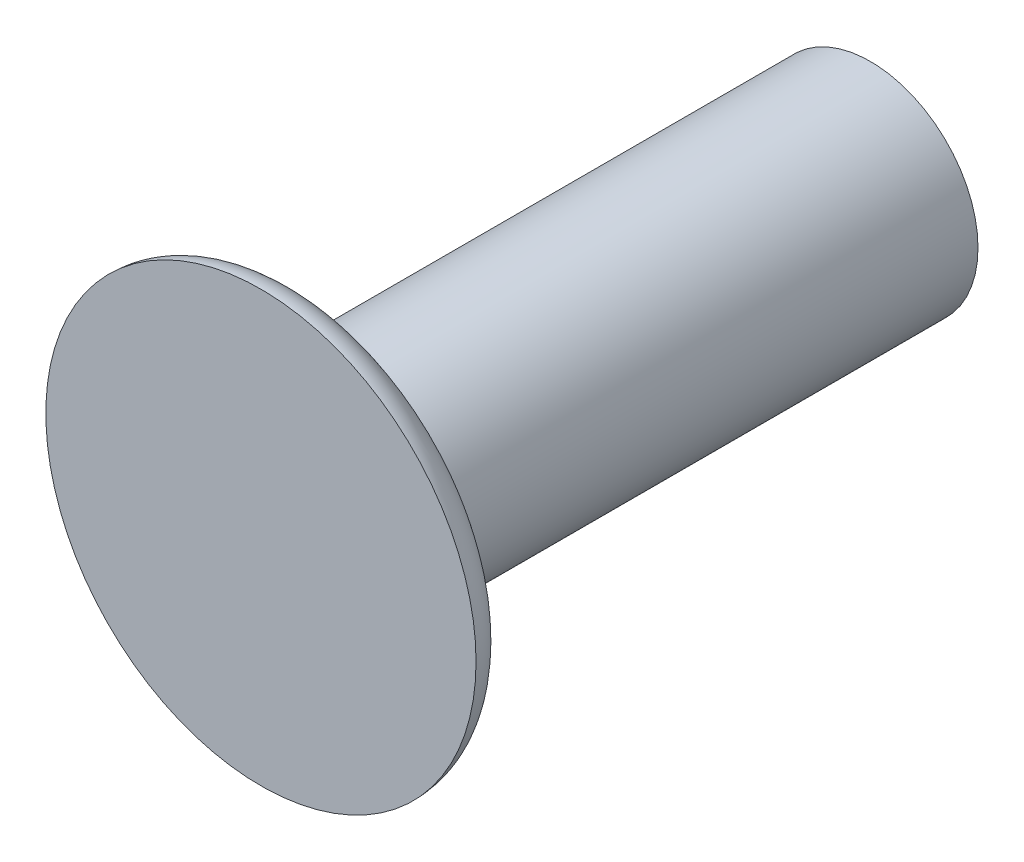
from build123d import *

# Parameters (mm, degrees)
SKETCH1_R           = 15
BOSS_EXTRUDE1_DEPTH = 80
SKETCH2_R           = 30
BOSS_EXTRUDE2_DEPTH = 5
FILLET1_R           = 5
SKETCH3_R           = 2
CUT_EXTRUDE1_DEPTH  = 5


with BuildPart() as part:
    # Sketch1 → Boss-Extrude1 (new body)
    with BuildSketch(Plane.XY):
        Circle(SKETCH1_R)
    extrude(amount=BOSS_EXTRUDE1_DEPTH)

    # Sketch2 → Boss-Extrude2 (add)
    with BuildSketch(Plane.XY.offset(80)):
        Circle(SKETCH2_R)
    extrude(amount=BOSS_EXTRUDE2_DEPTH)

    # Fillet1
    fillet1_edges = [part.edges().sort_by_distance(p)[0] for p in [
        (-15, 0, 80),
        (-30, 0, 80),
    ]]
    fillet(fillet1_edges, radius=FILLET1_R - 0.0001)  # a hair under: the kernel refuses the full size

    # Sketch3 → Cut-Extrude1 (cut)
    with BuildSketch(Plane(origin=(0, 0, 0), x_dir=(-1, 0, 0), z_dir=(0, 0, -1))):
        with Locations((0, 5)):
            Circle(SKETCH3_R)
        with Locations((0, -5)):
            Circle(SKETCH3_R)
    extrude(amount=-CUT_EXTRUDE1_DEPTH, mode=Mode.SUBTRACT)


solid = part.part
